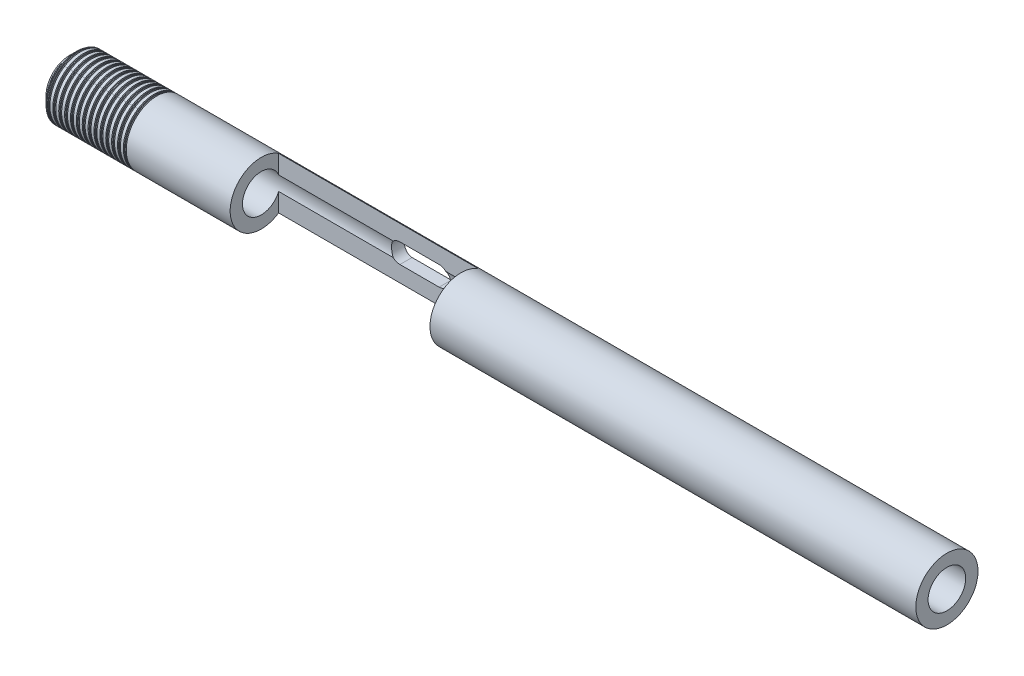
from build123d import *

# Parameters (mm, degrees)
SKETCH2_R                                           = 3.96875
SKETCH2_R_2                                         = 2.25
BODY_DEPTH                                          = 100
NOSE_START                                          = 12
SKETCH5_R                                           = 3.96875
NOSE_DEPTH                                          = 12
CHAMFER1_SIZE                                       = 1
SKETCH10_R                                          = 2.4
CUT_EXTRUDE3_DEPTH                                  = 113.140545536
CUT_SWEEP1_PITCH                                    = 0.75
CAVITY_FOR_SLIDER_DEPTH                             = 101.157385922
CAVITY_FOR_SLIDER_DEPTH_BACK                        = 101.157385922
SKETCH4_W                                           = 25.5
SKETCH4_H                                           = 13.71875
SLIDER_TRACK_FOR_SHAFT_OF_SHOULDER_SCREW_DEPTH      = 101.157385922
SLIDER_TRACK_FOR_SHAFT_OF_SHOULDER_SCREW_DEPTH_BACK = 101.157385922


with BuildPart() as part:
    # Sketch2 → Body (new body)
    with BuildSketch(Plane(origin=(0, 0, 0), x_dir=(0, 0, -1), z_dir=(1, 0, 0))):
        Circle(SKETCH2_R)
        Circle(SKETCH2_R_2, mode=Mode.SUBTRACT)
    extrude(amount=BODY_DEPTH)

    # Sketch5 → Nose (add)
    with BuildSketch(Plane.ZY.offset(NOSE_START)):
        Circle(SKETCH5_R)
    extrude(amount=-NOSE_DEPTH)

    # Chamfer1
    chamfer1_edges = [part.edges().sort_by_distance(p)[0] for p in [
        (-12, 0, -3.96875),
    ]]
    chamfer(chamfer1_edges, length=CHAMFER1_SIZE)

    # Sketch10 → Cut-Extrude3 (cut, through all)
    with BuildSketch(Plane.ZY.offset(12)):
        Circle(SKETCH10_R)
    extrude(amount=-CUT_EXTRUDE3_DEPTH, mode=Mode.SUBTRACT)

    # Cut-Sweep1: arcs per turn and ends read off the stored shape
    # Cut-Sweep1: the profile of Sketch7 screwed along a right-hand helix through 16 turns, 8 arcs to a turn; built about Z, then put on its axis
    cut_sweep1_z = Axis((0, 0, 0), (0, 0, 1))
    cut_sweep1_corners = [(3.96875, 0, -0.5625), (3.96875, 0, -0.609375), (3.5, 0, -0.65625), (3.5, 0, -0.75), (5.22410938, 0, -0.75), (5.22410938, 0, -0.375), (3.5, 0, -0.375), (3.5, 0, -0.46875), (3.96875, 0, -0.515625)]
    with BuildLine(mode=Mode.PRIVATE) as cut_sweep1_profile:
        Line(cut_sweep1_corners[0], cut_sweep1_corners[1])
        Line(cut_sweep1_corners[1], cut_sweep1_corners[2])
        Line(cut_sweep1_corners[2], cut_sweep1_corners[3])
        Line(cut_sweep1_corners[3], cut_sweep1_corners[4])
        Line(cut_sweep1_corners[4], cut_sweep1_corners[5])
        Line(cut_sweep1_corners[5], cut_sweep1_corners[6])
        Line(cut_sweep1_corners[6], cut_sweep1_corners[7])
        Line(cut_sweep1_corners[7], cut_sweep1_corners[8])
        Line(cut_sweep1_corners[8], cut_sweep1_corners[0])
    cut_sweep1_cap = Face(cut_sweep1_profile.wire())
    cut_sweep1_turn_angles = [0, 22.5, 45, 67.5, 90, 112.5, 135, 157.5, 180, 202.5, 225, 247.5, 270, 292.5, 315, 337.5, 360]
    cut_sweep1_turn_weights = [1, 0.9238795325112867, 1, 0.9238795325112867, 1, 0.9238795325112867, 1, 0.9238795325112867, 1, 0.9238795325112867, 1, 0.9238795325112867, 1, 0.9238795325112867, 1, 0.9238795325112867, 1]
    cut_sweep1_turn_rails = [Edge.make_bspline([Vector(p[0], p[1], 0).rotate(cut_sweep1_z, cut_sweep1_turn_angles[k]) / cut_sweep1_turn_weights[k] + Vector(0, 0, p[2] + CUT_SWEEP1_PITCH * cut_sweep1_turn_angles[k] / 360) for k in range(17)], [0, 0, 0, 1, 1, 2, 2, 3, 3, 4, 4, 5, 5, 6, 6, 7, 7, 8, 8, 8], 2, cut_sweep1_turn_weights) for p in cut_sweep1_corners]
    cut_sweep1_turn_sides = [Face.make_surface_from_curves(cut_sweep1_turn_rails[p[0]], cut_sweep1_turn_rails[p[1]]) for p in [(0, 1), (1, 2), (2, 3), (3, 4), (4, 5), (5, 6), (6, 7), (7, 8), (8, 0)]]
    cut_sweep1 = Plane(origin=(-12, 0, 0), x_dir=(0, 0, -1), z_dir=(1, 0, 0)) * Solid(Shell([*[p.moved(Location((0, 0, CUT_SWEEP1_PITCH * i))) for i in range(16) for p in cut_sweep1_turn_sides], cut_sweep1_cap, cut_sweep1_cap.rotate(cut_sweep1_z, 5760).moved(Location((0, 0, CUT_SWEEP1_PITCH * 5760 / 360)))]))
    add(cut_sweep1, mode=Mode.SUBTRACT)

    # Sketch4 → cavity for slider (cut, two sides: drawn at the far end of the back side and taken through both)
    with BuildSketch(Plane(origin=(0, 0, 0), x_dir=(1, 0, 0), z_dir=(0, 1, 0)).offset(-CAVITY_FOR_SLIDER_DEPTH_BACK)):
        with Locations((25.25, -4.640625)):
            Rectangle(SKETCH4_W, SKETCH4_H)
    extrude(amount=CAVITY_FOR_SLIDER_DEPTH + CAVITY_FOR_SLIDER_DEPTH_BACK, mode=Mode.SUBTRACT)

    # Sketch3 → slider track for shaft of shoulder screw (cut, two sides: drawn at the far end of the back side and taken through both)
    with BuildSketch(Plane.XY.offset(-SLIDER_TRACK_FOR_SHAFT_OF_SHOULDER_SCREW_DEPTH_BACK)):
        with BuildLine():
            Line((27.98, 1.25), (32.98, 1.25))
            ThreePointArc((32.98, 1.25), (34.23, 0), (32.98, -1.25))
            Line((32.98, -1.25), (27.98, -1.25))
            ThreePointArc((27.98, -1.25), (26.73, 0), (27.98, 1.25))
        make_face()
    extrude(amount=SLIDER_TRACK_FOR_SHAFT_OF_SHOULDER_SCREW_DEPTH + SLIDER_TRACK_FOR_SHAFT_OF_SHOULDER_SCREW_DEPTH_BACK, mode=Mode.SUBTRACT)


solid = part.part
